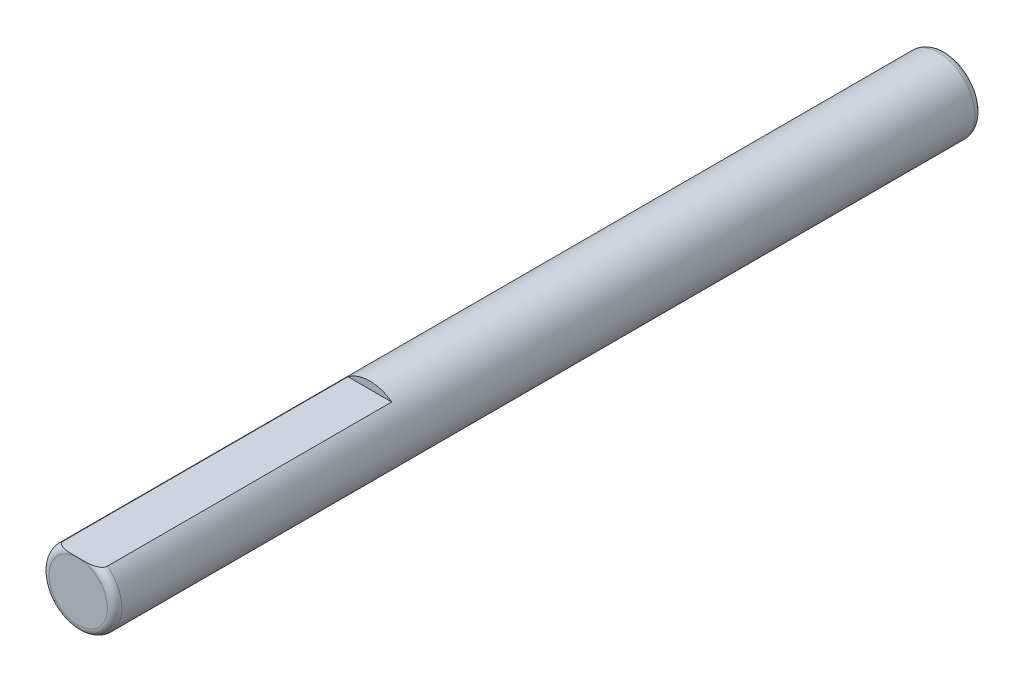
from build123d import *

# Parameters (mm, degrees)
SKETCH1_R           = 2.5
BOSS_EXTRUDE1_DEPTH = 29.75
CUT_EXTRUDE2_DEPTH  = 20
FILLET1_R           = 0.5


with BuildPart() as part:
    # Sketch1 → Boss-Extrude1 (new, symmetric)
    with BuildSketch(Plane.XY):
        with Locations(Location((0, 0, 0), (0, 0, 180))):
            Circle(SKETCH1_R)
    extrude(amount=BOSS_EXTRUDE1_DEPTH, both=True)

    # Sketch2 → Cut-Extrude2 (cut)
    with BuildSketch(Plane.XY.offset(29.75)):
        with BuildLine():
            ThreePointArc((1.5, 2), (0, 2.5), (-1.5, 2))
            Line((-1.5, 2), (1.5, 2))
        make_face()
    extrude(amount=-CUT_EXTRUDE2_DEPTH, mode=Mode.SUBTRACT)

    # Fillet1
    fillet1_edges = [part.edges().sort_by_distance(p)[0] for p in [
        (2.5, 0, -29.75),
        (1.118033989, -2.236067977, 29.75),
    ]]
    fillet(fillet1_edges, radius=FILLET1_R - 0.0001)  # a hair under: the kernel refuses the full size


solid = part.part
